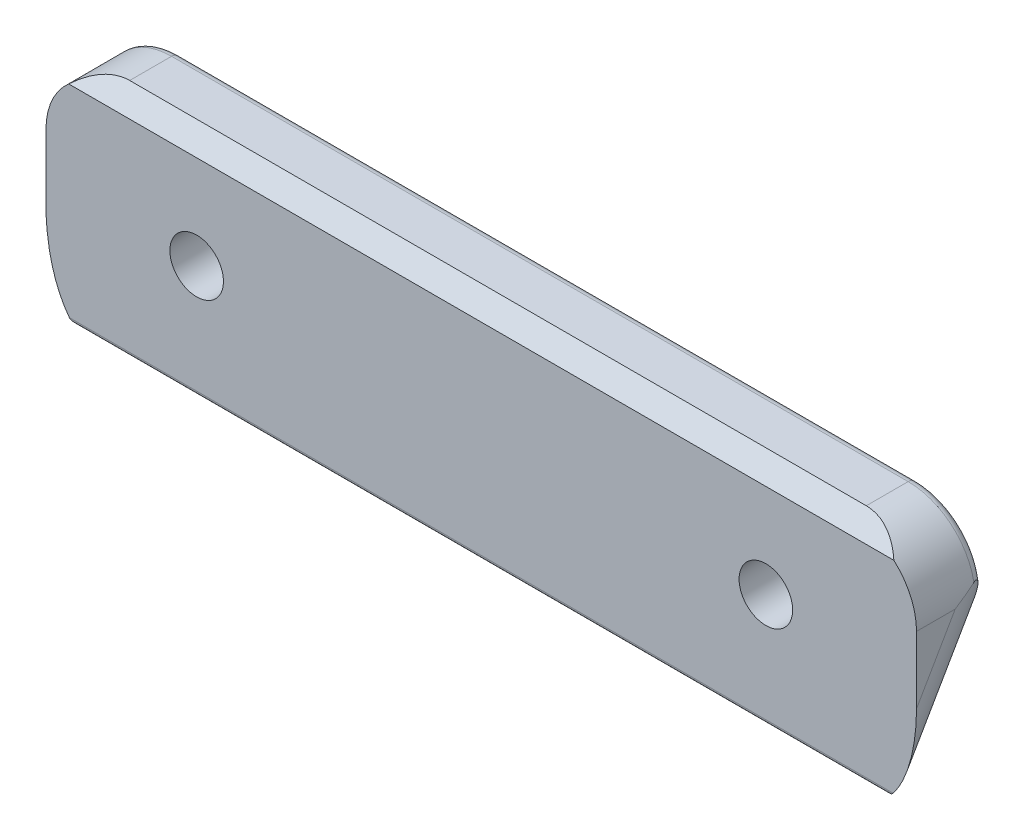
from build123d import *

# Parameters (mm, degrees)
WEDGE_GENERAL_SHAPE_DEPTH      = 73
SIDE_FILLET_R                  = 1.5
CORNER_START                   = -3
CORNER_FILLET_DEPTH            = 4
KNIFE_EDGE_REMOVER_R           = 0.125
CARD_GUIDE_SIZE                = 0.5
SKETCH14_W                     = 47
SKETCH14_H                     = 7
BABY_WEDGE_SHORTENER_DEPTH     = 10
BABY_WEDGE_SIDE_FILLET_R       = 1.5
BABY_START                     = -3
BABY_WEDGE_CORNER_FILLET_DEPTH = 4
M2X0_4_TAPPED_HOLE2_D          = 1.6
BABY_BITE_FILLET_R             = 0.25


with BuildPart() as part:
    # Sketch2 → Wedge General Shape (new body)
    with BuildSketch(Plane(origin=(0, 0, 0), x_dir=(0, 0, -1), z_dir=(1, 0, 0))):
        Polygon((0, 7), (0, 0), (2, 3.464101615), (2, 7), align=None)
    extrude(amount=WEDGE_GENERAL_SHAPE_DEPTH)

    # Side Fillet
    side_fillet_edges = [part.edges().sort_by_distance(p)[0] for p in [
        (73, 1.732050808, -1),
        (0, 1.732050808, -1),
    ]]
    fillet(side_fillet_edges, radius=SIDE_FILLET_R)

    # Corner Fillet: read off the stored shape, not the designer's step
    # Corner Fillet outline → Corner Fillet (cut)
    with BuildSketch(Plane.XY.offset(CORNER_START)):
        with BuildLine():
            Line((73, 7), (71, 7))
            ThreePointArc((71, 7), (72.414213562, 6.414213562), (73, 5))
            Line((73, 5), (73, 7))
        make_face()
        with BuildLine():
            ThreePointArc((0, 5), (0.585786438, 6.414213562), (2, 7))
            Line((2, 7), (0, 7))
            Line((0, 7), (0, 5))
        make_face()
    extrude(amount=CORNER_FILLET_DEPTH, mode=Mode.SUBTRACT)

    # Knife Edge Remover
    # the kernel refuses this fillet: 0.125 mm, written as the material it takes off along each edge
    with BuildSketch(Plane(origin=(0.333734123, 0, 0), x_dir=(0, 1, 0), z_dir=(1, 0, 0))) as knife_edge_remover_piece_1:
        with BuildLine():
            CenterArc((KNIFE_EDGE_REMOVER_R * 3.73205080757, -KNIFE_EDGE_REMOVER_R), KNIFE_EDGE_REMOVER_R, 90, 150)
            Line((KNIFE_EDGE_REMOVER_R * 3.23205080757, -KNIFE_EDGE_REMOVER_R * 1.86602540378), (0, 0))
            Line((0, 0), (KNIFE_EDGE_REMOVER_R * 3.73205080757, 0))
        make_face()
    extrude(amount=72.332531755, mode=Mode.SUBTRACT)

    # Card Guide
    # the kernel refuses this chamfer: 0.5 mm, written as the material it takes off along each edge
    with BuildSketch(Plane(origin=(-0.18593054, 7, 0), x_dir=(0, -1, 0), z_dir=(1, 0, 0))) as card_guide_piece_1:
        Polygon((CARD_GUIDE_SIZE, 0), (0, CARD_GUIDE_SIZE), (0, 0), align=None)
    extrude(amount=73.37186108, mode=Mode.SUBTRACT)

    # Sketch14 → Baby Wedge Shortener (cut)
    with BuildSketch(Plane.XY):
        with Locations((23.5, 3.5)):
            Rectangle(SKETCH14_W, SKETCH14_H)
    extrude(amount=-BABY_WEDGE_SHORTENER_DEPTH, mode=Mode.SUBTRACT)

    # Baby Wedge Side Fillet
    # the kernel refuses this fillet: 1.5 mm, written as the material it takes off along each edge
    with BuildSketch(Plane(origin=(47, -2.843588913, 1.641746825), x_dir=(0, 0.49999999999999317, 0.8660254037844426), z_dir=(0, 0.8660254037844427, -0.4999999999999932))) as baby_wedge_side_fillet_piece_1:
        with BuildLine():
            CenterArc((BABY_WEDGE_SIDE_FILLET_R, BABY_WEDGE_SIDE_FILLET_R), BABY_WEDGE_SIDE_FILLET_R, 180, 90)
            Line((0, BABY_WEDGE_SIDE_FILLET_R), (0, 0))
            Line((0, 0), (BABY_WEDGE_SIDE_FILLET_R, 0))
        make_face()
    extrude(amount=11.033493649, mode=Mode.SUBTRACT)

    # Baby Wedge Corner Fillet: read off the stored shape, not the designer's step
    # Baby Wedge Corner Fillet outline → Baby Wedge Corner Fillet (cut)
    with BuildSketch(Plane.XY.offset(BABY_START)):
        with BuildLine():
            ThreePointArc((47, 5), (47.585786438, 6.414213562), (49, 7))
            Line((49, 7), (47, 7))
            Line((47, 7), (47, 5))
        make_face()
    extrude(amount=BABY_WEDGE_CORNER_FILLET_DEPTH, mode=Mode.SUBTRACT)

    # M2x0.4 Tapped Hole2 (through all)
    with Locations(Plane(origin=(0, 0, -2), x_dir=(-1, 0, 0), z_dir=(0, 0, -1))):
        with Locations((-68.5, 3.702003175), (-51.5, 3.702003175)):
            Hole(M2X0_4_TAPPED_HOLE2_D / 2)

    # Baby Bite Fillet
    baby_bite_fillet_edges = [part.edges().sort_by_distance(p)[0] for p in [
        (47.790438534, 6.592784059, -2),
        (72.209561466, 6.592784059, -2),
        (60, 7, -2),
    ]]
    fillet(baby_bite_fillet_edges, radius=BABY_BITE_FILLET_R)


solid = part.part
